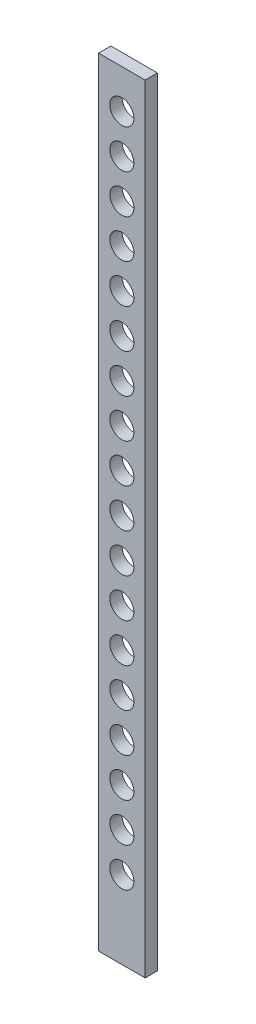
from build123d import *

# Parameters (mm, degrees)
SKETCH1_W           = 6
SKETCH1_H           = 100
MAINBODY_DEPTH      = 1.5875
PEGHOLE_REACH       = 52.115
SKETCH2_R           = 1.55
LPATTERN1_COUNT     = 9
LPATTERN1_PITCH     = 5
LPATTERN2_OUTLINE_R = 1.55
LPATTERN2_DEPTH     = 1.5875


# Read off the part's stored shape, not the designer's step: LPattern2
with BuildPart() as part:
    # Sketch1 → MainBody (new body)
    with BuildSketch(Plane.XY):
        Rectangle(SKETCH1_W, SKETCH1_H)
    extrude(amount=MAINBODY_DEPTH)

    # Sketch2 → PegHole (cut, up to next)
    with BuildSketch(Plane.XY.offset(1.5875), mode=Mode.PRIVATE) as peghole_sk1:
        Circle(SKETCH2_R)
    peghole_tool1 = extrude(peghole_sk1.sketch, amount=-PEGHOLE_REACH, mode=Mode.PRIVATE) & part.part
    peghole = peghole_tool1.solids().sort_by_distance((0, 0, 1.5875))[0]
    add(peghole, mode=Mode.SUBTRACT)

    # LPattern1: PegHole ×9
    with Locations(*[(0, -i * LPATTERN1_PITCH, 0) for i in range(1, LPATTERN1_COUNT)]):
        add(peghole, mode=Mode.SUBTRACT)

    # LPattern2 outline → LPattern2 (cut)
    with BuildSketch(Plane.XY):
        with Locations((0, 5)):
            Circle(LPATTERN2_OUTLINE_R)
        with Locations((0, 10)):
            Circle(LPATTERN2_OUTLINE_R)
        with Locations((0, 15)):
            Circle(LPATTERN2_OUTLINE_R)
        with Locations((0, 20)):
            Circle(LPATTERN2_OUTLINE_R)
        with Locations((0, 25)):
            Circle(LPATTERN2_OUTLINE_R)
        with Locations((0, 30)):
            Circle(LPATTERN2_OUTLINE_R)
        with Locations((0, 35)):
            Circle(LPATTERN2_OUTLINE_R)
        with Locations((0, 40)):
            Circle(LPATTERN2_OUTLINE_R)
        with Locations((0, 45)):
            Circle(LPATTERN2_OUTLINE_R)
    extrude(amount=LPATTERN2_DEPTH, mode=Mode.SUBTRACT)


solid = part.part
